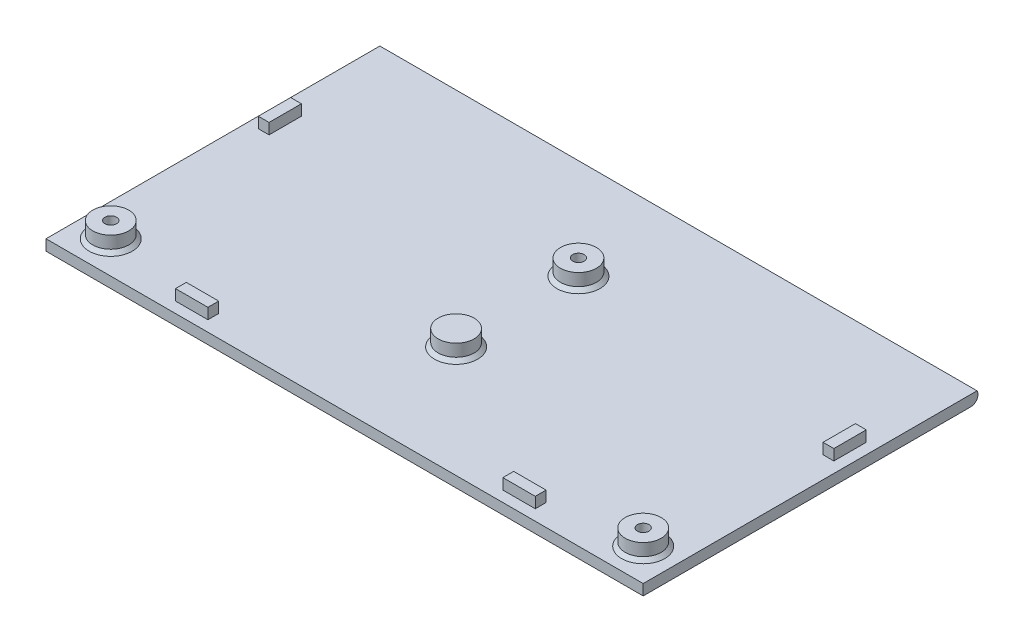
from build123d import *

# Parameters (mm, degrees)
EXTRUDE_1_DEPTH     = 83
EXTRUDE_START       = 3
SKETCH_2_R          = 5
EXTRUDE_2_DEPTH     = 4.4
SKETCH_3_R          = 1.6
CUT_EXTRUDE_1_DEPTH = 7.4
CHAMFER_1_SIZE      = 2
SKETCH_4_W          = 9
SKETCH_4_H          = 3
SKETCH_4_W_2        = 3
SKETCH_4_H_2        = 9
EXTRUDE_3_DEPTH     = 3
CHAMFER_2_SIZE      = 1
FILLET_1_R          = 2


with BuildPart() as part:
    # 草图1 → 凸台-拉伸1 (new, symmetric)
    with BuildSketch(Plane(origin=(0, 0, 0), x_dir=(0, 0, -1), z_dir=(1, 0, 0))):
        Polygon((0, 3), (0, 0), (95.8, 0), (92.8, 3), align=None)
    extrude(amount=EXTRUDE_1_DEPTH, both=True)

    # 草图2 → 凸台-拉伸2 (add)
    with BuildSketch(Plane(origin=(0, 0, 0), x_dir=(1, 0, 0), z_dir=(0, 1, 0)).offset(EXTRUDE_START)):
        with Locations(Location((-74, 9, 0), (0, 0, 90))):
            Circle(SKETCH_2_R)
        with Locations(Location((74, 9, 0), (0, 0, 90))):
            Circle(SKETCH_2_R)
        with Locations(Location((0, 65, 0), (0, 0, 90))):
            Circle(SKETCH_2_R)
        with Locations(Location((0, 31, 0), (0, 0, 90))):
            Circle(SKETCH_2_R)
    extrude(amount=EXTRUDE_2_DEPTH)

    # 草图3 → 切除-拉伸1 (cut)
    with BuildSketch(Plane(origin=(0, 0, 0), x_dir=(1, 0, 0), z_dir=(0, 1, 0))):
        with Locations(Location((74, 9, 0), (0, 0, 90))):
            Circle(SKETCH_3_R)
        with Locations(Location((-74, 9, 0), (0, 0, 90))):
            Circle(SKETCH_3_R)
        with Locations(Location((0, 65, 0), (0, 0, 90))):
            Circle(SKETCH_3_R)
    extrude(amount=CUT_EXTRUDE_1_DEPTH, mode=Mode.SUBTRACT)

    # 倒角1
    chamfer_1_edges = [part.edges().sort_by_distance(p)[0] for p in [
        (74, 0, -7.4),
        (-74, 0, -7.4),
        (0, 0, -63.4),
    ]]
    chamfer(chamfer_1_edges, length=CHAMFER_1_SIZE)

    # 草图4 → 凸台-拉伸3 (add)
    with BuildSketch(Plane(origin=(0, 0, 0), x_dir=(1, 0, 0), z_dir=(0, 1, 0)).offset(EXTRUDE_START)):
        with Locations((45.5, 4.5)):
            Rectangle(SKETCH_4_W, SKETCH_4_H)
        with Locations((-45.5, 4.5)):
            Rectangle(SKETCH_4_W, SKETCH_4_H)
        with Locations((-78.5, 60.5)):
            Rectangle(SKETCH_4_W_2, SKETCH_4_H_2)
        with Locations((78.5, 60.5)):
            Rectangle(SKETCH_4_W_2, SKETCH_4_H_2)
    extrude(amount=EXTRUDE_3_DEPTH)

    # 倒角2
    chamfer_2_edges = [part.edges().sort_by_distance(p)[0] for p in [
        (-74, 3, -4),
        (74, 3, -4),
        (0, 3, -60),
        (0, 3, -26),
    ]]
    chamfer(chamfer_2_edges, length=CHAMFER_2_SIZE)

    # 圆角1
    # the kernel refuses this fillet: 2 mm, written as the material it takes off along each edge
    with BuildSketch(Plane(origin=(-94.830127019, 0, -95.8), x_dir=(0, 0.7071067811865416, 0.7071067811865535), z_dir=(1, 0, 0))) as fillet_1_piece_1:
        with BuildLine():
            CenterArc((4.760278777, 1.931851653), FILLET_1_R, 135, 120)
            Line((3.346065215, 3.346065215), (3.317780944, 3.374349486))
            Line((3.317780944, 3.374349486), (-0.028284271, 0.028284271))
            Line((-0.028284271, 0.028284271), (0, -0.04))
            ThreePointArc((0, -0.04), (2.121320344, -0.04), (4.232287925, -0.038637033))
            Line((4.232287925, -0.038637033), (4.242640687, 0))
        make_face()
    extrude(amount=189.660254038, mode=Mode.SUBTRACT)


solid = part.part
